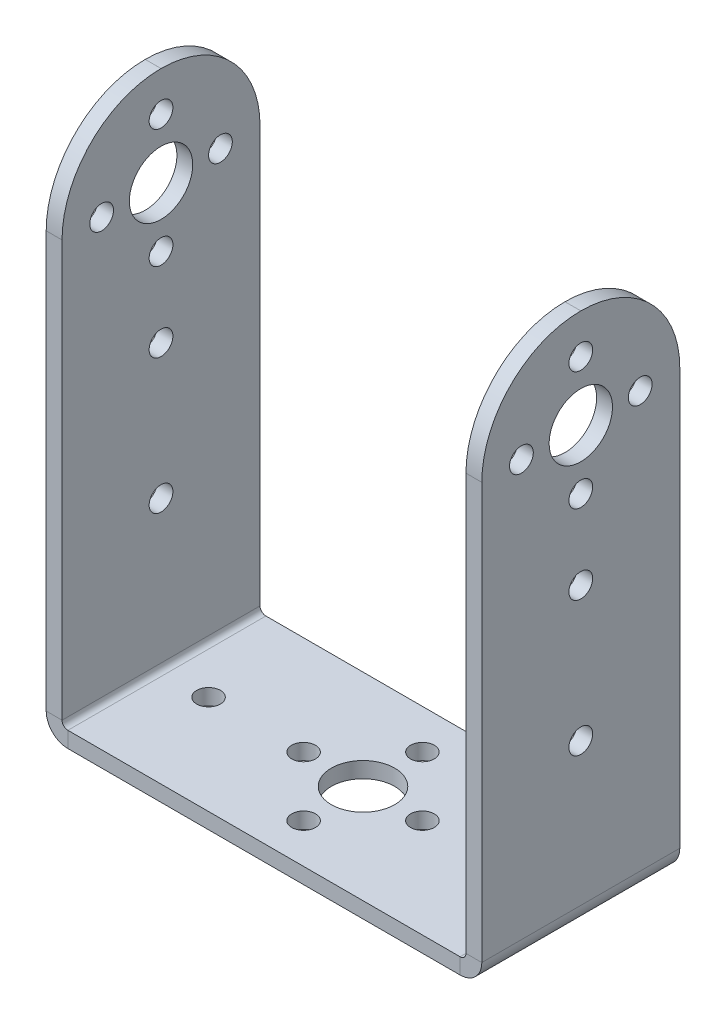
from build123d import *

# Parameters (mm, degrees)
SKETCH1_R                  = 4
SKETCH1_R_2                = 1.5
BASE_FLANGE1_DEPTH         = 2
SKETCHED_START             = -92.5
SKETCHED_BEND1_OUTLINE_W   = 2
SKETCHED_BEND1_OUTLINE_H   = 25
SKETCHED_BEND1_DEPTH       = 65
SKETCHED_START_2           = 27.5
SKETCHED_BEND1_2_OUTLINE_W = 2
SKETCHED_BEND1_2_OUTLINE_H = 25
SKETCHED_BEND1_2_DEPTH     = 65
SKETCHED_START_3           = -27.5
SKETCHED_BEND1_3_OUTLINE_R = 1.5
SKETCHED_BEND1_3_DEPTH     = 2.7366
SKETCHED_START_4           = 24.7634
SKETCHED_BEND1_4_OUTLINE_R = 1.5
SKETCHED_BEND1_4_DEPTH     = 2.7366
SKETCHED_BEND1_5_DEPTH     = 2
SKETCHED_START_5           = 25.5
SKETCHED_BEND1_6_DEPTH     = 2
SKETCHED_START_6           = -12.5
SKETCHED_BEND1_7_DEPTH     = 25


with BuildPart() as part:
    # Base-Flange1: sheet metal written as solids
    # Sketch1 → Base-Flange1 (new body)
    with BuildSketch(Plane(origin=(0, 0, 0), x_dir=(1, 0, 0), z_dir=(0, 1, 0))):
        with BuildLine():
            Line((-92.5, -0.001), (-92.5, 0.001))
            ThreePointArc((-92.5, 0.001), (-88.839127658, 8.839127658), (-80.001, 12.5))
            Line((-80.001, 12.5), (80.001, 12.5))
            ThreePointArc((80.001, 12.5), (88.839127658, 8.839127658), (92.5, 0.001))
            Line((92.5, 0.001), (92.5, -0.001))
            ThreePointArc((92.5, -0.001), (88.839127658, -8.839127658), (80.001, -12.5))
            Line((80.001, -12.5), (-80.001, -12.5))
            ThreePointArc((-80.001, -12.5), (-88.839127658, -8.839127658), (-92.5, -0.001))
        make_face()
        with Locations(Location((0, 0, 0), (0, 0, 270))):
            Circle(SKETCH1_R, mode=Mode.SUBTRACT)
        with Locations(Location((0, 7.5, 0), (0, 0, 270))):
            Circle(SKETCH1_R_2, mode=Mode.SUBTRACT)
        with Locations(Location((7.5, 0, 0), (0, 0, 270))):
            Circle(SKETCH1_R_2, mode=Mode.SUBTRACT)
        with Locations(Location((0, -7.5, 0), (0, 0, 270))):
            Circle(SKETCH1_R_2, mode=Mode.SUBTRACT)
        with Locations(Location((-7.5, 0, 0), (0, 0, 270))):
            Circle(SKETCH1_R_2, mode=Mode.SUBTRACT)
        with Locations(Location((72.501, 0.001, 0), (0, 0, 270))):
            Circle(SKETCH1_R_2, mode=Mode.SUBTRACT)
        with Locations(Location((80.001, 0.001, 0), (0, 0, 270))):
            Circle(SKETCH1_R, mode=Mode.SUBTRACT)
        with Locations(Location((80.001, -7.499, 0), (0, 0, 270))):
            Circle(SKETCH1_R_2, mode=Mode.SUBTRACT)
        with Locations(Location((87.501, 0.001, 0), (0, 0, 270))):
            Circle(SKETCH1_R_2, mode=Mode.SUBTRACT)
        with Locations(Location((80.001, 7.501, 0), (0, 0, 270))):
            Circle(SKETCH1_R_2, mode=Mode.SUBTRACT)
        with Locations(Location((-80.001, 7.499, 0), (0, 0, 270))):
            Circle(SKETCH1_R_2, mode=Mode.SUBTRACT)
        with Locations(Location((-87.501, -0.001, 0), (0, 0, 270))):
            Circle(SKETCH1_R_2, mode=Mode.SUBTRACT)
        with Locations(Location((-80.001, -0.001, 0), (0, 0, 270))):
            Circle(SKETCH1_R, mode=Mode.SUBTRACT)
        with Locations(Location((-72.501, -0.001, 0), (0, 0, 270))):
            Circle(SKETCH1_R_2, mode=Mode.SUBTRACT)
        with Locations(Location((-80.001, -7.501, 0), (0, 0, 270))):
            Circle(SKETCH1_R_2, mode=Mode.SUBTRACT)
        with Locations(Location((-62.501, -0.001, 0), (0, 0, 270))):
            Circle(SKETCH1_R_2, mode=Mode.SUBTRACT)
        with Locations(Location((-45.501, -0.001, 0), (0, 0, 270))):
            Circle(SKETCH1_R_2, mode=Mode.SUBTRACT)
        with Locations(Location((45.501, -0.001, 0), (0, 0, 90))):
            Circle(SKETCH1_R_2, mode=Mode.SUBTRACT)
        with Locations(Location((62.501, -0.001, 0), (0, 0, 90))):
            Circle(SKETCH1_R_2, mode=Mode.SUBTRACT)
        with Locations(Location((19.5, 0, 0), (0, 0, 270))):
            Circle(SKETCH1_R_2, mode=Mode.SUBTRACT)
        with Locations(Location((-19.5, 0, 0), (0, 0, 90))):
            Circle(SKETCH1_R_2, mode=Mode.SUBTRACT)
    extrude(amount=-BASE_FLANGE1_DEPTH)

    # Sketched Bend1: read off the stored shape, not the designer's step
    # Sketched Bend1 outline → Sketched Bend1 (cut)
    with BuildSketch(Plane.YZ.offset(SKETCHED_START)):
        with Locations((-1, 0)):
            Rectangle(SKETCHED_BEND1_OUTLINE_W, SKETCHED_BEND1_OUTLINE_H)
    extrude(amount=SKETCHED_BEND1_DEPTH, mode=Mode.SUBTRACT)

    # Sketched Bend1 2 outline → Sketched Bend1 2 (cut)
    with BuildSketch(Plane.YZ.offset(SKETCHED_START_2)):
        with Locations((-1, 0)):
            Rectangle(SKETCHED_BEND1_2_OUTLINE_W, SKETCHED_BEND1_2_OUTLINE_H)
    extrude(amount=SKETCHED_BEND1_2_DEPTH, mode=Mode.SUBTRACT)

    # Sketched Bend1 3 outline → Sketched Bend1 3 (add)
    with BuildSketch(Plane.YZ.offset(SKETCHED_START_3)):
        with BuildLine():
            Line((0, 12.5), (0, -12.5))
            Line((0, -12.5), (53.246355099, -12.5))
            ThreePointArc((53.246355099, -12.5), (62.084482757, -8.839127658), (65.745355099, -0.001))
            Line((65.745355099, -0.001), (65.745355099, 0.001))
            ThreePointArc((65.745355099, 0.001), (62.084482757, 8.839127658), (53.246355099, 12.5))
            Line((53.246355099, 12.5), (0, 12.5))
        make_face()
        with BuildLine():
            ThreePointArc((54.746353766, -7.499000002), (53.246855098, -9.000999917), (51.746355432, -7.5))
            ThreePointArc((51.746355432, -7.5), (53.245855099, -5.999000083), (54.746353766, -7.499000002))
        make_face(mode=Mode.SUBTRACT)
        with Locations((18.746355099, 0.001)):
            Circle(SKETCHED_BEND1_3_OUTLINE_R, mode=Mode.SUBTRACT)
        with Locations((35.746355099, 0.001)):
            Circle(SKETCHED_BEND1_3_OUTLINE_R, mode=Mode.SUBTRACT)
        with BuildLine():
            ThreePointArc((47.246353766, 0.000999998), (45.746855098, -1.500999917), (44.246355432, 0))
            ThreePointArc((44.246355432, 0), (45.745855099, 1.500999917), (47.246353766, 0.000999998))
        make_face(mode=Mode.SUBTRACT)
        with BuildLine():
            ThreePointArc((57.246354599, 0.001), (53.246855099, -4.000999969), (49.246355224, 0))
            ThreePointArc((49.246355224, 0), (53.245855099, 4.000999969), (57.246354599, 0.001))
        make_face(mode=Mode.SUBTRACT)
        with BuildLine():
            ThreePointArc((62.246353766, 0.000999998), (60.746855098, -1.500999917), (59.246355432, 0))
            ThreePointArc((59.246355432, 0), (60.745855099, 1.500999917), (62.246353766, 0.000999998))
        make_face(mode=Mode.SUBTRACT)
        with BuildLine():
            ThreePointArc((54.746353766, 7.500999998), (53.246855098, 5.999000083), (51.746355432, 7.5))
            ThreePointArc((51.746355432, 7.5), (53.245855099, 9.000999917), (54.746353766, 7.500999998))
        make_face(mode=Mode.SUBTRACT)
    extrude(amount=SKETCHED_BEND1_3_DEPTH)

    # Sketched Bend1 4 outline → Sketched Bend1 4 (add)
    with BuildSketch(Plane.YZ.offset(SKETCHED_START_4)):
        with BuildLine():
            Line((0, 12.5), (0, -12.5))
            Line((0, -12.5), (53.246355099, -12.5))
            ThreePointArc((53.246355099, -12.5), (62.084482757, -8.839127658), (65.745355099, -0.001))
            Line((65.745355099, -0.001), (65.745355099, 0.001))
            ThreePointArc((65.745355099, 0.001), (62.084482757, 8.839127658), (53.246355099, 12.5))
            Line((53.246355099, 12.5), (0, 12.5))
        make_face()
        with BuildLine():
            ThreePointArc((54.746353766, -7.499000002), (53.246855098, -9.000999917), (51.746355432, -7.5))
            ThreePointArc((51.746355432, -7.5), (53.245855099, -5.999000083), (54.746353766, -7.499000002))
        make_face(mode=Mode.SUBTRACT)
        with Locations((18.746355099, 0.001)):
            Circle(SKETCHED_BEND1_4_OUTLINE_R, mode=Mode.SUBTRACT)
        with Locations((35.746355099, 0.001)):
            Circle(SKETCHED_BEND1_4_OUTLINE_R, mode=Mode.SUBTRACT)
        with BuildLine():
            ThreePointArc((47.246353766, 0.000999998), (45.746855098, -1.500999917), (44.246355432, 0))
            ThreePointArc((44.246355432, 0), (45.745855099, 1.500999917), (47.246353766, 0.000999998))
        make_face(mode=Mode.SUBTRACT)
        with BuildLine():
            ThreePointArc((57.246354599, 0.001), (53.246855099, -4.000999969), (49.246355224, 0))
            ThreePointArc((49.246355224, 0), (53.245855099, 4.000999969), (57.246354599, 0.001))
        make_face(mode=Mode.SUBTRACT)
        with BuildLine():
            ThreePointArc((62.246353766, 0.000999998), (60.746855098, -1.500999917), (59.246355432, 0))
            ThreePointArc((59.246355432, 0), (60.745855099, 1.500999917), (62.246353766, 0.000999998))
        make_face(mode=Mode.SUBTRACT)
        with BuildLine():
            ThreePointArc((54.746353766, 7.500999998), (53.246855098, 5.999000083), (51.746355432, 7.5))
            ThreePointArc((51.746355432, 7.5), (53.245855099, 9.000999917), (54.746353766, 7.500999998))
        make_face(mode=Mode.SUBTRACT)
    extrude(amount=SKETCHED_BEND1_4_DEPTH)

    # Sketched Bend1 5 outline → Sketched Bend1 5 (add)
    with BuildSketch(Plane.YZ.offset(SKETCHED_START_3)):
        with BuildLine():
            ThreePointArc((44.246355432, 0), (45.745855099, -1.500999917), (47.246355099, -0.001))
            ThreePointArc((47.246355099, -0.001), (45.7458551, -1.498999917), (44.246355432, 0))
        make_face()
        with BuildLine():
            ThreePointArc((51.746355432, 7.5), (53.245855099, 5.999000083), (54.746355099, 7.499))
            ThreePointArc((54.746355099, 7.499), (53.2458551, 6.001000083), (51.746355432, 7.5))
        make_face()
        with BuildLine():
            ThreePointArc((59.246355432, 0), (60.745855099, -1.500999917), (62.246355099, -0.001))
            ThreePointArc((62.246355099, -0.001), (60.7458551, -1.498999917), (59.246355432, 0))
        make_face()
        with BuildLine():
            ThreePointArc((51.746355432, -7.5), (53.245855099, -9.000999917), (54.746355099, -7.501))
            ThreePointArc((54.746355099, -7.501), (53.2458551, -8.998999917), (51.746355432, -7.5))
        make_face()
        with BuildLine():
            ThreePointArc((49.246355224, 0), (53.245855099, -4.000999969), (57.246355099, -0.001))
            ThreePointArc((57.246355099, -0.001), (53.245855099, -3.998999969), (49.246355224, 0))
        make_face()
    extrude(amount=SKETCHED_BEND1_5_DEPTH)

    # Sketched Bend1 6 outline → Sketched Bend1 6 (add)
    with BuildSketch(Plane.YZ.offset(SKETCHED_START_5)):
        with BuildLine():
            ThreePointArc((44.246355432, 0), (45.7458551, 1.498999917), (47.246353766, 0.000999998))
            ThreePointArc((47.246353766, 0.000999998), (45.745855099, 1.500999917), (44.246355432, 0))
        make_face()
        with BuildLine():
            ThreePointArc((51.746355432, 7.5), (53.2458551, 8.998999917), (54.746353766, 7.500999998))
            ThreePointArc((54.746353766, 7.500999998), (53.245855099, 9.000999917), (51.746355432, 7.5))
        make_face()
        with BuildLine():
            ThreePointArc((59.246355432, 0), (60.7458551, 1.498999917), (62.246353766, 0.000999998))
            ThreePointArc((62.246353766, 0.000999998), (60.745855099, 1.500999917), (59.246355432, 0))
        make_face()
        with BuildLine():
            ThreePointArc((51.746355432, -7.5), (53.2458551, -6.001000083), (54.746353766, -7.499000002))
            ThreePointArc((54.746353766, -7.499000002), (53.245855099, -5.999000083), (51.746355432, -7.5))
        make_face()
        with BuildLine():
            ThreePointArc((49.246355224, 0), (53.245855099, 3.998999969), (57.246354599, 0.001))
            ThreePointArc((57.246354599, 0.001), (53.245855099, 4.000999969), (49.246355224, 0))
        make_face()
    extrude(amount=SKETCHED_BEND1_6_DEPTH)

    # Sketched Bend1 7 outline → Sketched Bend1 7 (cut)
    with BuildSketch(Plane.XY.offset(SKETCHED_START_6)):
        with BuildLine():
            Line((25.5, 0.7366), (25.5, 65.745355099))
            Line((25.5, 65.745355099), (24.7634, 65.745355099))
            Line((24.7634, 65.745355099), (24.7634, 0))
            ThreePointArc((24.7634, 0), (25.284254855, 0.215745145), (25.5, 0.7366))
        make_face()
        with BuildLine():
            Line((-24.7634, 65.745355099), (-25.5, 65.745355099))
            Line((-25.5, 65.745355099), (-25.5, 0.7366))
            ThreePointArc((-25.5, 0.7366), (-25.284254855, 0.215745145), (-24.7634, 0))
            Line((-24.7634, 0), (-24.7634, 65.745355099))
        make_face()
        with BuildLine():
            Line((-27.5, -2), (-24.7634, -2))
            ThreePointArc((-24.7634, -2), (-26.698468417, -1.198468417), (-27.5, 0.7366))
            Line((-27.5, 0.7366), (-27.5, -2))
        make_face()
        with BuildLine():
            ThreePointArc((27.5, 0.7366), (26.698468417, -1.198468417), (24.7634, -2))
            Line((24.7634, -2), (27.5, -2))
            Line((27.5, -2), (27.5, 0.7366))
        make_face()
    extrude(amount=SKETCHED_BEND1_7_DEPTH, mode=Mode.SUBTRACT)


solid = part.part
